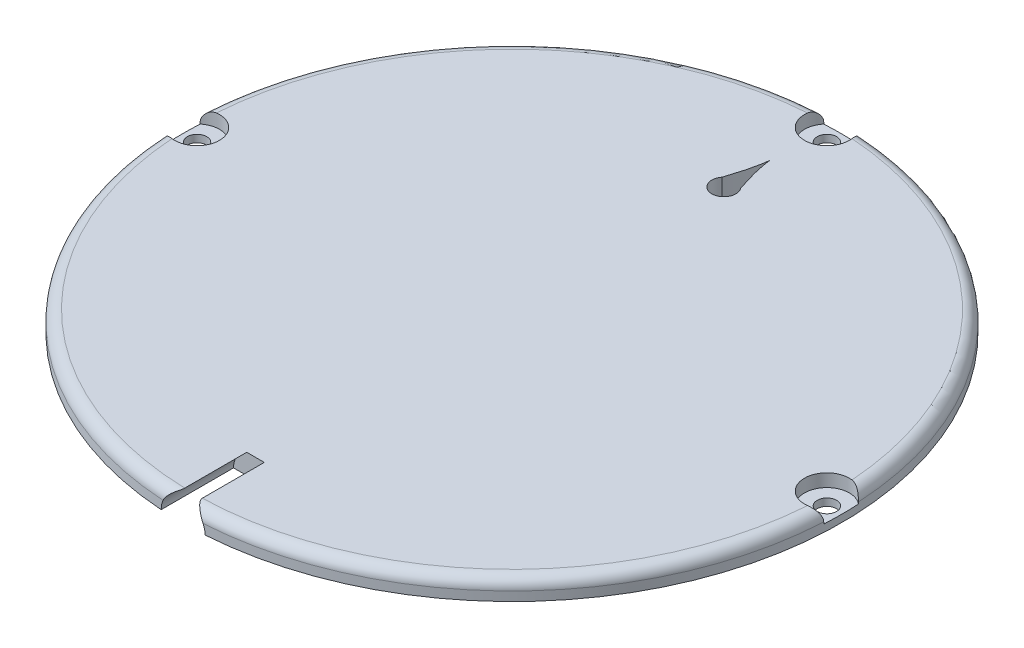
from build123d import *

# Parameters (mm, degrees)
SKETCH1_R                                    = 90
BOSS_EXTRUDE1_DEPTH                          = 5.5
CBORE_FOR_M5_HEX_HEAD_CAP_SCREW1_D           = 5.3
CBORE_FOR_M5_HEX_HEAD_CAP_SCREW1_DEPTH       = 6
CBORE_FOR_M5_HEX_HEAD_CAP_SCREW1_CBORE_D     = 12.238
CBORE_FOR_M5_HEX_HEAD_CAP_SCREW1_CBORE_DEPTH = 3.5
CBORE_FOR_M5_HEX_HEAD_CAP_SCREW1_TIP         = 1.59228064
FILLET1_R                                    = 3
CUT_EXTRUDE1_DEPTH                           = 31
CUT_REVOLVE_THIN8_START                      = 70.039018211
CUT_REVOLVE_THIN8_DEPTH                      = 19.960981889


# Read off the part's stored shape, not the designer's step: Cut-Revolve-Thin8
with BuildPart() as part:
    # Sketch1 → Boss-Extrude1 (new body)
    with BuildSketch(Plane(origin=(0, 0, 0), x_dir=(1, 0, 0), z_dir=(0, 1, 0))):
        with Locations(Location((0, 0, 0), (0, 0, 270))):
            Circle(SKETCH1_R)
    extrude(amount=BOSS_EXTRUDE1_DEPTH)

    # CBORE for M5 Hex Head Cap Screw1
    with Locations(Plane(origin=(0, 5.5, 0), x_dir=(1, 0, 0), z_dir=(0, 1, 0))):
        with Locations((0, 86), (-86, 0), (86, 0)):
            CounterBoreHole(CBORE_FOR_M5_HEX_HEAD_CAP_SCREW1_D / 2, CBORE_FOR_M5_HEX_HEAD_CAP_SCREW1_CBORE_D / 2, CBORE_FOR_M5_HEX_HEAD_CAP_SCREW1_CBORE_DEPTH, depth=CBORE_FOR_M5_HEX_HEAD_CAP_SCREW1_DEPTH)
            with Locations((0, 0, -(CBORE_FOR_M5_HEX_HEAD_CAP_SCREW1_DEPTH + CBORE_FOR_M5_HEX_HEAD_CAP_SCREW1_TIP / 2))):  # 118° drill point
                Cone(0, CBORE_FOR_M5_HEX_HEAD_CAP_SCREW1_D / 2, CBORE_FOR_M5_HEX_HEAD_CAP_SCREW1_TIP, mode=Mode.SUBTRACT)

    # Fillet1
    fillet1_edges = [part.edges().sort_by_distance(p)[0] for p in [
        (-61.942775174, 5.5, 65.292362523),
        (-63.639610307, 5.5, -63.639610307),
        (63.639610307, 5.5, -63.639610307),
    ]]
    fillet(fillet1_edges, radius=FILLET1_R)

    # Sketch5 → Cut-Extrude1 (cut)
    with BuildSketch(Plane(origin=(0, 5.5, 0), x_dir=(1, 0, 0), z_dir=(0, 1, 0))):
        with BuildLine():
            add(Edge.make_bspline(
                [(-3.285569008, 57.868614525), (-3.024078757, 58.587053083), (-2.783851066, 59.272048996), (-2.563116696, 59.924191453)],
                knots=[0, 0, 0, 0, 0.04164671, 0.04164671, 0.04164671, 0.04164671], degree=3))
            ThreePointArc((-3.285569008, 57.868614525), (0, 54.583045517), (3.285569008, 57.868614525))
            add(Edge.make_bspline(
                [(2.563054058, 59.924269555), (2.783803493, 59.272145294), (3.0240518, 58.587127147), (3.285569008, 57.868614525)],
                knots=[0.958431192, 0.958431192, 0.958431192, 0.958431192, 1, 1, 1, 1], degree=3))
            ThreePointArc((2.563054058, 59.924269555), (-5.0059e-05, 61.154183532), (-2.563116696, 59.924191453))
        make_face()
        with BuildLine():
            ThreePointArc((-2.563116696, 59.924191453), (-3.099698411, 58.958033389), (-3.285569008, 57.868614525))
            add(Edge.make_bspline(
                [(-3.285569008, 57.868614525), (-3.024078757, 58.587053083), (-2.783851066, 59.272048996), (-2.563116696, 59.924191453)],
                knots=[0, 0, 0, 0, 0.04164671, 0.04164671, 0.04164671, 0.04164671], degree=3))
        make_face()
        with BuildLine():
            add(Edge.make_bspline(
                [(2.563054058, 59.924269555), (2.783803493, 59.272145294), (3.0240518, 58.587127147), (3.285569008, 57.868614525)],
                knots=[0.958431192, 0.958431192, 0.958431192, 0.958431192, 1, 1, 1, 1], degree=3))
            ThreePointArc((3.285569008, 57.868614525), (3.099681813, 58.958080616), (2.563054058, 59.924269555))
        make_face()
        with BuildLine():
            add(Edge.make_bspline(
                [(-2.563116696, 59.924191453), (-0.133769336, 67.101508499), (0.002619877, 73.497835408), (0.128574166, 67.116058723), (2.563054058, 59.924269555)],
                knots=[0.04164671, 0.04164671, 0.04164671, 0.04164671, 0.5, 0.958431192, 0.958431192, 0.958431192, 0.958431192], degree=3))
            ThreePointArc((-2.563116696, 59.924191453), (-5.0059e-05, 61.154183532), (2.563054058, 59.924269555))
        make_face()
    extrude(amount=-CUT_EXTRUDE1_DEPTH, mode=Mode.SUBTRACT)

    # Cut-Revolve-Thin8 outline → Cut-Revolve-Thin8 (cut)
    with BuildSketch(Plane.XY.offset(CUT_REVOLVE_THIN8_START)):
        with BuildLine():
            Line((-6, 0), (6, 0))
            ThreePointArc((6, 0), (5.019337335, 3.287286528), (2.397915762, 5.5))
            Line((2.397915762, 5.5), (-2.397915762, 5.5))
            ThreePointArc((-2.397915762, 5.5), (-5.019337335, 3.287286528), (-6, 0))
        make_face()
    extrude(amount=CUT_REVOLVE_THIN8_DEPTH, mode=Mode.SUBTRACT)


solid = part.part
